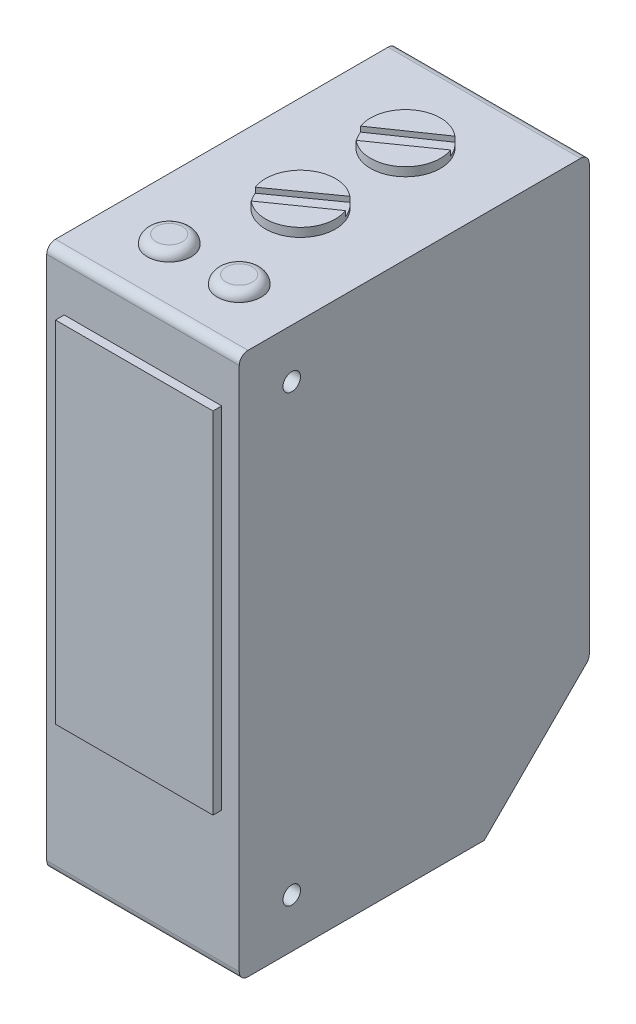
from build123d import *

# Parameters (mm, degrees)
BOSS_EXTRUDE1_DEPTH = 11
SKETCH2_R           = 0.5
CUT_EXTRUDE1_DEPTH  = 39.49675311
SKETCH3_W           = 9
SKETCH3_H           = 20
BOSS_EXTRUDE2_DEPTH = 0.5
SKETCH5_R           = 1.25
SKETCH5_R_2         = 2
BOSS_EXTRUDE3_DEPTH = 0.5
FILLET2_R           = 0.5
FILLET3_R           = 0.5
FILLET4_R           = 0.5
FILLET5_R           = 0.5
FILLET6_R           = 0.5
FILLET7_R           = 0.5
CUT_EXTRUDE3_START  = -0.3
CUT_EXTRUDE3_DEPTH  = 0.3


with BuildPart() as part:
    # Sketch1 → Boss-Extrude1 (new body)
    with BuildSketch(Plane(origin=(0, 0, 0), x_dir=(0, 0, -1), z_dir=(1, 0, 0))):
        Polygon((0, 0), (0, 31), (20, 31), (20, 6), (14, 0), align=None)
    extrude(amount=BOSS_EXTRUDE1_DEPTH)

    # Sketch2 → Cut-Extrude1 (cut, through all)
    with BuildSketch(Plane(origin=(11, 0, 0), x_dir=(0, 0, -1), z_dir=(1, 0, 0))):
        with Locations((3, 2.8)):
            Circle(SKETCH2_R)
        with Locations((3, 28.2)):
            Circle(SKETCH2_R)
    extrude(amount=-CUT_EXTRUDE1_DEPTH, mode=Mode.SUBTRACT)

    # Sketch3 → Boss-Extrude2 (add)
    with BuildSketch(Plane.XY):
        with Locations((5.5, 18)):
            Rectangle(SKETCH3_W, SKETCH3_H)
    extrude(amount=BOSS_EXTRUDE2_DEPTH)

    # Sketch5 → Boss-Extrude3 (add)
    with BuildSketch(Plane(origin=(0, 31, 0), x_dir=(1, 0, 0), z_dir=(0, 1, 0))):
        with Locations(Location((3.5, 3.5, 0), (0, 0, 90))):
            Circle(SKETCH5_R)
        with Locations(Location((7.5, 3.5, 0), (0, 0, 90))):
            Circle(SKETCH5_R)
        with Locations(Location((5.5, 15, 0), (0, 0, 90))):
            Circle(SKETCH5_R_2)
        with Locations(Location((5.5, 9, 0), (0, 0, 90))):
            Circle(SKETCH5_R_2)
    extrude(amount=BOSS_EXTRUDE3_DEPTH)

    # Fillet2
    fillet2_edges = [part.edges().sort_by_distance(p)[0] for p in [
        (3.5, 31.5, -2.25),
    ]]
    fillet(fillet2_edges, radius=FILLET2_R - 0.0001)  # a hair under: the kernel refuses the full size

    # Fillet3
    fillet3_edges = [part.edges().sort_by_distance(p)[0] for p in [
        (7.5, 31.5, -2.25),
    ]]
    fillet(fillet3_edges, radius=FILLET3_R - 0.0001)  # a hair under: the kernel refuses the full size

    # Fillet4
    fillet4_edges = [part.edges().sort_by_distance(p)[0] for p in [
        (5.5, 31, 0),
    ]]
    fillet(fillet4_edges, radius=FILLET4_R)

    # Fillet5
    fillet5_edges = [part.edges().sort_by_distance(p)[0] for p in [
        (5.5, 31, -20),
    ]]
    fillet(fillet5_edges, radius=FILLET5_R)

    # Fillet6
    fillet6_edges = [part.edges().sort_by_distance(p)[0] for p in [
        (5.5, 0, 0),
    ]]
    fillet(fillet6_edges, radius=FILLET6_R)

    # Fillet7
    fillet7_edges = [part.edges().sort_by_distance(p)[0] for p in [
        (5.5, 6, -20),
    ]]
    fillet(fillet7_edges, radius=FILLET7_R)

    # Sketch6 → Cut-Extrude3 (cut)
    with BuildSketch(Plane(origin=(0, 31.5, 0), x_dir=(1, 0, 0), z_dir=(0, 1, 0)).offset(CUT_EXTRUDE3_START)):
        with BuildLine():
            Line((6.786176444, 10.531584197), (3.6331206, 8.282531321))
            ThreePointArc((3.6331206, 8.282531321), (3.86671689, 7.84570962), (4.200507105, 7.479697985))
            Line((4.200507105, 7.479697985), (7.373069331, 9.701149971))
            ThreePointArc((7.373069331, 9.701149971), (7.13328311, 10.15429038), (6.786176444, 10.531584197))
        make_face()
        with BuildLine():
            Line((3.62088338, 14.315222133), (6.812710383, 16.508904056))
            ThreePointArc((6.812710383, 16.508904056), (7.143293876, 16.139993525), (7.373069331, 15.701149971))
            Line((7.373069331, 15.701149971), (4.200507105, 13.479697985))
            ThreePointArc((4.200507105, 13.479697985), (3.856706124, 13.860006475), (3.62088338, 14.315222133))
        make_face()
    extrude(amount=CUT_EXTRUDE3_DEPTH, mode=Mode.SUBTRACT)


solid = part.part
